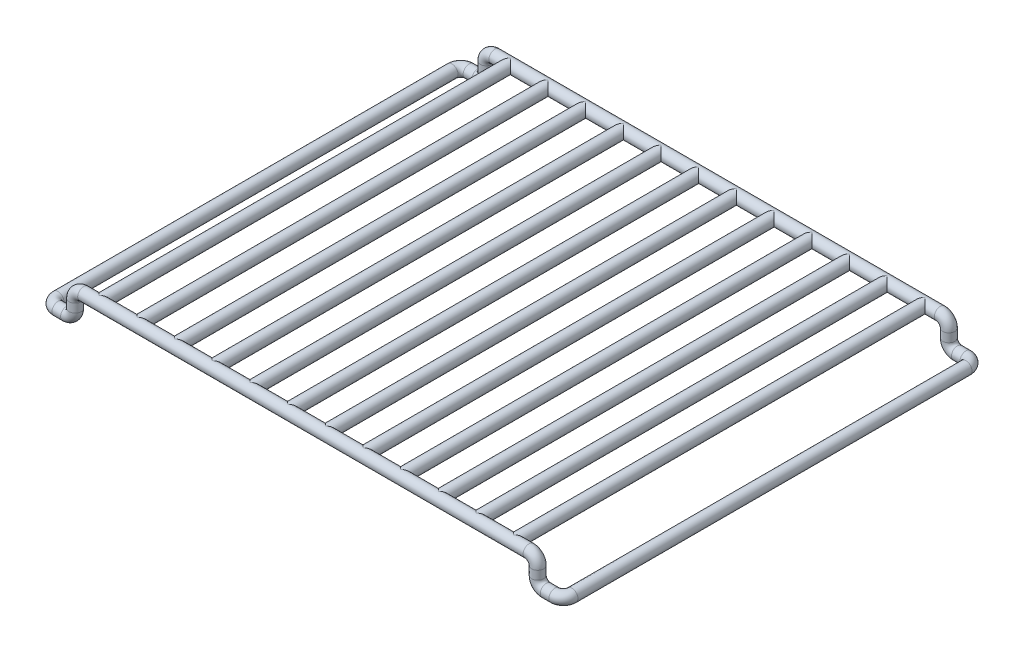
from build123d import *

# Parameters (mm, degrees)
SKETCH1_R                            = 3.5
SKETCH1_R_2                          = 2.5
EXTRUDE_THIN4_REACH                  = 199.881
EXTRUDE_THIN4_END_RADIUS             = 3.5
SKETCH3_R                            = 3.5
SKETCH3_R_2                          = 2.5
EXTRUDE_THIN4_DIRECTION_2_REACH      = 199.881
EXTRUDE_THIN4_DIRECTION_2_END_RADIUS = 3.5
LPATTERN1_COUNT                      = 6
LPATTERN1_PITCH                      = 22


# Read off the part's stored shape, not the designer's step: Mirror1
with BuildPart() as part:
    # Sweep-Thin1: sweep along a curve in space
    with BuildLine() as sweep_thin1_path:
        Line((0, 0, 120), (130, 0, 120))
        ThreePointArc((130, 0, 120), (133.535533906, -1.464466094, 120), (135, -5, 120))
        Line((135, -5, 120), (135, -10, 120))
        ThreePointArc((135, -10, 120), (136.464466094, -13.535533906, 120), (140, -15, 120))
        Line((140, -15, 120), (145, -15, 120))
        ThreePointArc((145, -15, 120), (148.535533906, -15, 118.535533906), (150, -15, 115))
        Line((150, -15, 115), (150, -15, -115))
        ThreePointArc((150, -15, -115), (148.535533906, -15, -118.535533906), (145, -15, -120))
        Line((145, -15, -120), (140, -15, -120))
        ThreePointArc((140, -15, -120), (136.464466094, -13.535533906, -120), (135, -10, -120))
        Line((135, -10, -120), (135, -5, -120))
        ThreePointArc((135, -5, -120), (133.535533906, -1.464466094, -120), (130, 0, -120))
        Line((130, 0, -120), (0, 0, -120))
    # Sketch1 → Sweep-Thin1 (sweep)
    with BuildSketch(Plane(origin=(0, 0, 0), x_dir=(0, 0, -1), z_dir=(1, 0, 0))):
        with Locations((-120, 0)):
            Circle(SKETCH1_R)
        with Locations((-120, 0)):
            Circle(SKETCH1_R_2, mode=Mode.SUBTRACT)
    sweep(path=sweep_thin1_path.line)

    # Extrude-Thin4: up to this cylinder (the profile starts outside it)
    extrude_thin4_end = Plane(origin=(7.598995, 0, 120), z_dir=(-1, 0, 0)) * Cylinder(EXTRUDE_THIN4_END_RADIUS, 407.762, mode=Mode.PRIVATE)
    # Sketch3 → Extrude-Thin4 (add, up to the surface)
    with BuildSketch(Plane.XY, mode=Mode.PRIVATE) as extrude_thin4_sk1:
        with Locations((11, 0)):
            Circle(SKETCH3_R)
        with Locations((11, 0)):
            Circle(SKETCH3_R_2, mode=Mode.SUBTRACT)
    extrude_thin4_tool1 = extrude(extrude_thin4_sk1.sketch, amount=EXTRUDE_THIN4_REACH, mode=Mode.PRIVATE) - extrude_thin4_end
    extrude_thin4 = extrude_thin4_tool1.solids().sort_by_distance((7.598995, 0, 0))[0]
    add(extrude_thin4)

    # Extrude-Thin4 direction 2: up to this cylinder (the profile starts outside it)
    extrude_thin4_direction_2_end = Plane(origin=(7.598995, 0, -120), z_dir=(-1, 0, 0)) * Cylinder(EXTRUDE_THIN4_DIRECTION_2_END_RADIUS, 407.762, mode=Mode.PRIVATE)
    # Sketch3 → Extrude-Thin4 direction 2 (add, up to the surface)
    with BuildSketch(Plane.XY, mode=Mode.PRIVATE) as extrude_thin4_direction_2_sk1:
        with Locations((11, 0)):
            Circle(SKETCH3_R)
        with Locations((11, 0)):
            Circle(SKETCH3_R_2, mode=Mode.SUBTRACT)
    extrude_thin4_direction_2_tool1 = extrude(extrude_thin4_direction_2_sk1.sketch, amount=-EXTRUDE_THIN4_DIRECTION_2_REACH, mode=Mode.PRIVATE) - extrude_thin4_direction_2_end
    extrude_thin4_direction_2 = extrude_thin4_direction_2_tool1.solids().sort_by_distance((7.598995, 0, 0))[0]
    add(extrude_thin4_direction_2)
    extrude_thin4 = extrude_thin4 + extrude_thin4_direction_2  # both directions under the feature's name, for the pattern or mirror that repeats it

    # LPattern1: Extrude-Thin4 ×6
    with Locations(*[(i * LPATTERN1_PITCH, 0, 0) for i in range(1, LPATTERN1_COUNT)]):
        add(extrude_thin4)

    # Mirror1: part across plane


with BuildPart() as part_1:
    add(part.part)
    add(part.part.mirror(Plane(origin=(0, 0, 0), x_dir=(0, 0, 1), z_dir=(1, 0, 0))))


solid = part_1.part
